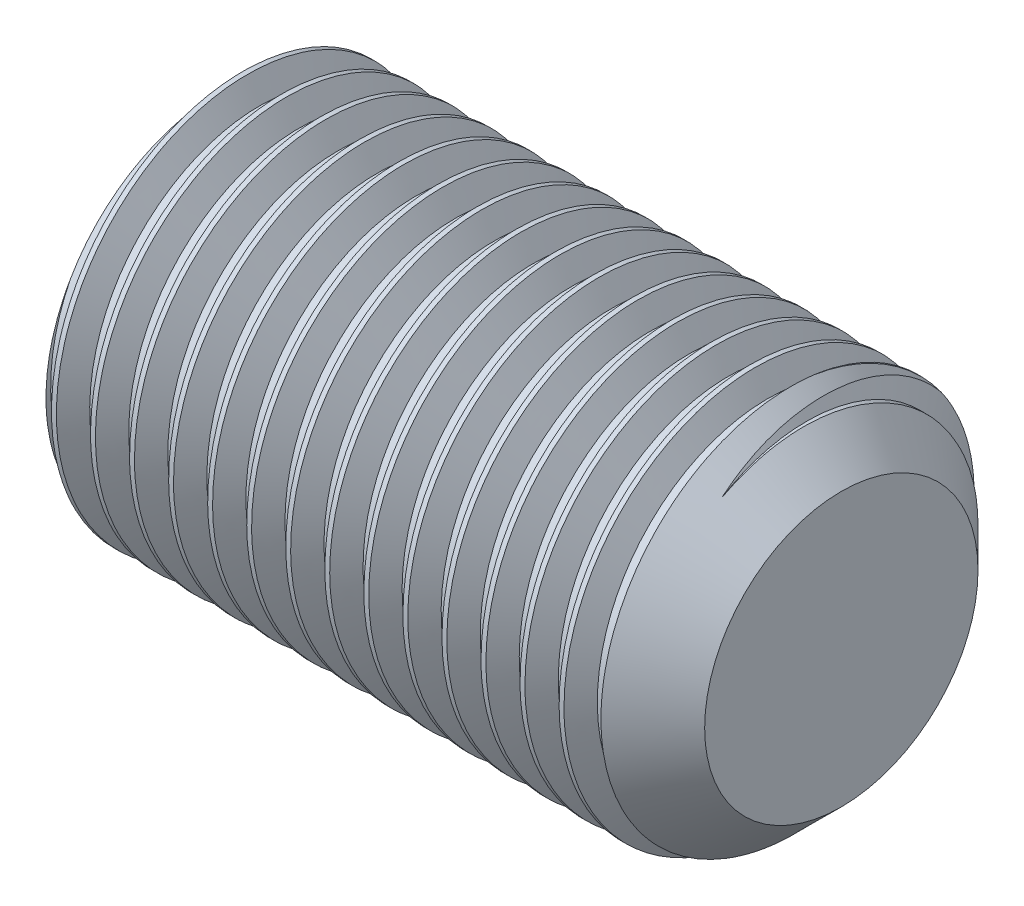
from build123d import *

# Parameters (mm, degrees)
F_5_0_5_DIAMETER_HOLE1_D     = 5
F_5_0_5_DIAMETER_HOLE1_DEPTH = 6
F_5_0_5_DIAMETER_HOLE1_TIP   = 1.502151548
CUT_EXTRUDE1_DEPTH           = 6
THREAD1_PITCH                = 1


with BuildPart() as part:
    # Sketch1 → Revolve1 (revolve)
    with BuildSketch(Plane(origin=(0, 0, 0), x_dir=(1, 0, 0), z_dir=(0, 1, 0)), mode=Mode.PRIVATE) as revolve1_sk:
        Polygon((0, 4.2), (0.4, 5), (14.5, 5), (16, 3.5), (16, 0), (0, 0), align=None)
    revolve(revolve1_sk.sketch.rotate(Axis((0, 0, 0), (1, 0, 0)), 180), axis=Axis((0, 0, 0), (1, 0, 0)))

    # Ø5.0 (5) Diameter Hole1
    with Locations(Plane.ZY):
        with Locations((0, 0)):
            Hole(F_5_0_5_DIAMETER_HOLE1_D / 2, depth=F_5_0_5_DIAMETER_HOLE1_DEPTH)
            with Locations((0, 0, -(F_5_0_5_DIAMETER_HOLE1_DEPTH + F_5_0_5_DIAMETER_HOLE1_TIP / 2))):  # 118° drill point
                Cone(0, F_5_0_5_DIAMETER_HOLE1_D / 2, F_5_0_5_DIAMETER_HOLE1_TIP, mode=Mode.SUBTRACT)

    # Sketch4 → Cut-Extrude1 (cut)
    with BuildSketch(Plane.ZY):
        Polygon((1.443375673, 2.5), (-1.443375673, 2.5), (-2.886751346, 0), (-1.443375673, -2.5), (1.443375673, -2.5), (2.886751346, 0), align=None)
    extrude(amount=-CUT_EXTRUDE1_DEPTH, mode=Mode.SUBTRACT)

    # Thread1: arcs per turn and ends read off the stored shape
    # Thread1: the profile of Thread Profile1 profile screwed along a right-hand helix through 16.1 turns, 8 arcs to a turn; built about Z, then put on its axis
    thread1_z = Axis((0, 0, 0), (0, 0, 1))
    thread1_corners = [(5.0003, 0, -0.000173205), (5.0003, 0, 0.875173202), (4.458734125, 0, 0.562499999), (4.458734125, 0, 0.312499999)]
    with BuildLine(mode=Mode.PRIVATE) as thread1_profile:
        Line(thread1_corners[0], thread1_corners[1])
        Line(thread1_corners[1], thread1_corners[2])
        Line(thread1_corners[2], thread1_corners[3])
        Line(thread1_corners[3], thread1_corners[0])
    thread1_cap = Face(thread1_profile.wire())
    thread1_turn_angles = [0, 22.5, 45, 67.5, 90, 112.5, 135, 157.5, 180, 202.5, 225, 247.5, 270, 292.5, 315, 337.5, 360]
    thread1_turn_weights = [1, 0.9238795325112867, 1, 0.9238795325112867, 1, 0.9238795325112867, 1, 0.9238795325112867, 1, 0.9238795325112867, 1, 0.9238795325112867, 1, 0.9238795325112867, 1, 0.9238795325112867, 1]
    thread1_turn_rails = [Edge.make_bspline([Vector(p[0], p[1], 0).rotate(thread1_z, thread1_turn_angles[k]) / thread1_turn_weights[k] + Vector(0, 0, p[2] + THREAD1_PITCH * thread1_turn_angles[k] / 360) for k in range(17)], [0, 0, 0, 1, 1, 2, 2, 3, 3, 4, 4, 5, 5, 6, 6, 7, 7, 8, 8, 8], 2, thread1_turn_weights) for p in thread1_corners]
    thread1_turn_sides = [Face.make_surface_from_curves(thread1_turn_rails[p[0]], thread1_turn_rails[p[1]]) for p in [(0, 1), (1, 2), (2, 3), (3, 0)]]
    thread1_last_angles = [5760, 5778, 5796]
    thread1_last_weights = [1, 0.9510565162951535, 1]
    thread1_last_rails = [Edge.make_bspline([Vector(p[0], p[1], 0).rotate(thread1_z, thread1_last_angles[k]) / thread1_last_weights[k] + Vector(0, 0, p[2] + THREAD1_PITCH * thread1_last_angles[k] / 360) for k in range(3)], [0, 0, 0, 1, 1, 1], 2, thread1_last_weights) for p in thread1_corners]
    thread1_last_sides = [Face.make_surface_from_curves(thread1_last_rails[p[0]], thread1_last_rails[p[1]]) for p in [(0, 1), (1, 2), (2, 3), (3, 0)]]
    thread1 = Plane(origin=(-0.6, 0, 0), x_dir=(0, 0, -1), z_dir=(1, 0, 0)) * Solid(Shell([*[p.moved(Location((0, 0, THREAD1_PITCH * i))) for i in range(16) for p in thread1_turn_sides], *thread1_last_sides, thread1_cap, thread1_cap.rotate(thread1_z, 5796).moved(Location((0, 0, THREAD1_PITCH * 5796 / 360)))]))
    add(thread1, mode=Mode.SUBTRACT)


solid = part.part
